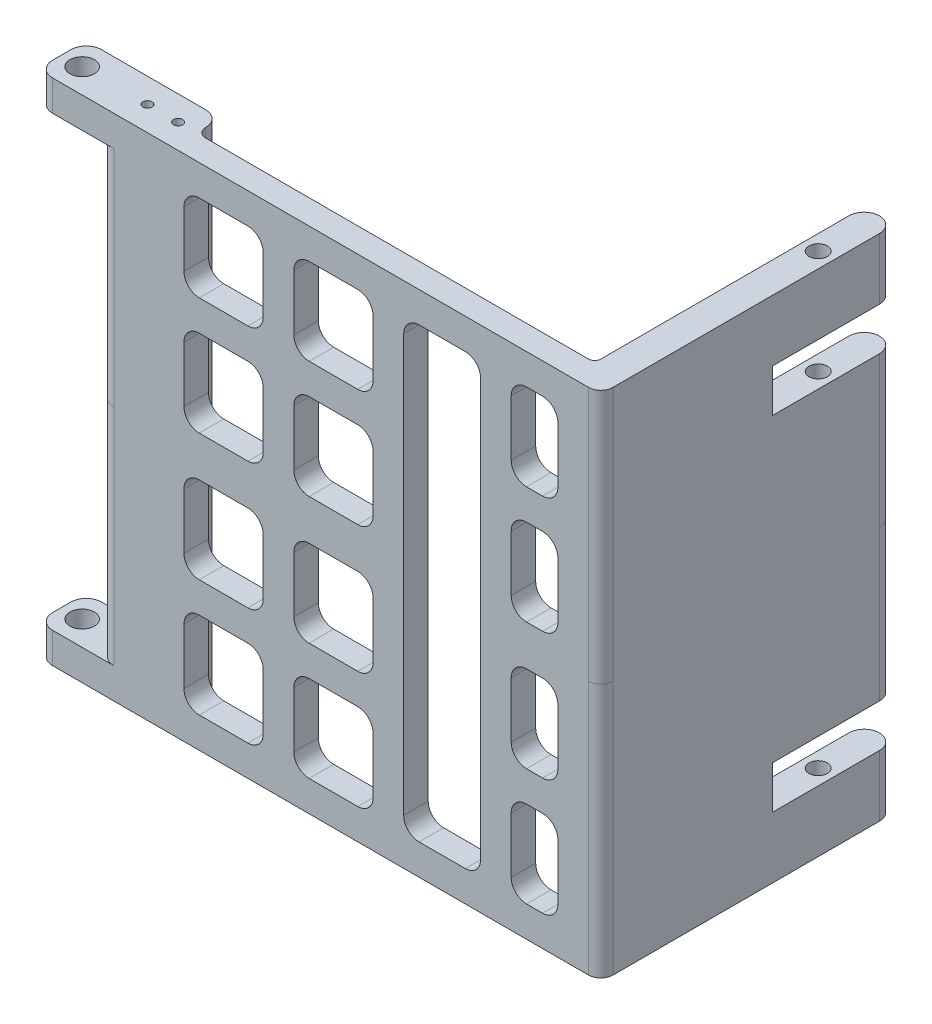
from build123d import *

# Parameters (mm, degrees)
ESBO_O2_W                = 82
ESBO_O2_H                = 41.55
RESSALTO_EXTRUS_O1_DEPTH = 8
ESBO_O3_R                = 0.75
CORTE_EXTRUS_O1_DEPTH    = 80.4806199
ESBO_O7_W                = 40
ESBO_O7_H                = 41.55
RESSALTO_EXTRUS_O2_DEPTH = 5
FILETE1_R                = 2
CORTE_EXTRUS_O3_START    = -8
CORTE_EXTRUS_O3_DEPTH    = 98.795934894
ESBO_O12_W               = 20
ESBO_O12_H               = 7
CORTE_EXTRUS_O4_DEPTH    = 10
ESBO_O19_R               = 1.5
CORTE_EXTRUS_O7_DEPTH    = 89.61810729
ESBO_O17_W               = 10
ESBO_O17_H               = 5
RESSALTO_EXTRUS_O4_DEPTH = 8
ESBO_O20_R               = 2
CORTE_EXTRUS_O9_DEPTH    = 8
FILETE2_R                = 2.5
FILETE3_R                = 2.5
FILETE4_R                = 2.5
FILETE5_R                = 2.5
ESBO_O25_W               = 65
ESBO_O25_H               = 4
CORTE_EXTRUS_O10_DEPTH   = 97.430254151
FILETE8_R                = 1
FILETE9_R                = 2.5
FILETE10_R               = 2.5
FILETE11_R               = 2.5
FILETE12_R               = 1.5
FILETE1_OF_ESPELHAR1_R   = 2
FILETE2_OF_ESPELHAR1_R   = 2.5
FILETE3_OF_ESPELHAR1_R   = 2.5
FILETE4_OF_ESPELHAR1_R   = 2.5
FILETE5_OF_ESPELHAR1_R   = 2.5
FILETE8_OF_ESPELHAR1_R   = 1
FILETE9_OF_ESPELHAR1_R   = 2.5
FILETE10_OF_ESPELHAR1_R  = 2.5
FILETE11_OF_ESPELHAR1_R  = 2.5
FILETE12_OF_ESPELHAR1_R  = 1.5


with BuildPart() as part:
    # Esboço2 → Ressalto-extrusão1 (new body)
    with BuildSketch(Plane.XY):
        with Locations((-26.281248797, -14.332598663)):
            Rectangle(ESBO_O2_W, ESBO_O2_H)
    ressalto_extrus_o1 = extrude(amount=RESSALTO_EXTRUS_O1_DEPTH)

    # Esboço3 → Corte-extrusão1 (cut, through all)
    with BuildSketch(Plane(origin=(0, -35.107598663, 0), x_dir=(-1, 0, 0), z_dir=(0, -1, 0))):
        with Locations(Location((58.281248797, -4, 0), (0, 0, 90))):
            Circle(ESBO_O3_R)
        with Locations(Location((63.281248797, -4, 0), (0, 0, 90))):
            Circle(ESBO_O3_R)
    corte_extrus_o1 = extrude(amount=-CORTE_EXTRUS_O1_DEPTH, mode=Mode.SUBTRACT)

    # Esboço7 → Ressalto-extrusão2 (add)
    with BuildSketch(Plane(origin=(14.718751203, 0, 0), x_dir=(0, 0, -1), z_dir=(1, 0, 0))):
        with Locations((20, -14.332598663)):
            Rectangle(ESBO_O7_W, ESBO_O7_H)
    ressalto_extrus_o2 = extrude(amount=-RESSALTO_EXTRUS_O2_DEPTH)

    # Filete1
    filete1_edges = [part.edges().sort_by_distance(p)[0] for p in [
        (14.718751203, -14.332598663, 8),
    ]]
    fillet(filete1_edges, radius=FILETE1_R)

    # Esboço11 → Corte-extrusão3 (cut)
    with BuildSketch(Plane.XY.offset(8).offset(CORTE_EXTRUS_O3_START)):
        with BuildLine():
            Line((-50.831248797, -30.107598663), (-42.891248797, -30.107598663))
            ThreePointArc((-42.891248797, -30.107598663), (-41.123481844, -29.375365616), (-40.391248797, -27.607598663))
            Line((-40.391248797, -27.607598663), (-40.391248797, -18.487598663))
            ThreePointArc((-40.391248797, -18.487598663), (-41.123481844, -16.71983171), (-42.891248797, -15.987598663))
            Line((-42.891248797, -15.987598663), (-50.831248797, -15.987598663))
            ThreePointArc((-50.831248797, -15.987598663), (-52.59901575, -16.71983171), (-53.331248797, -18.487598663))
            Line((-53.331248797, -18.487598663), (-53.331248797, -27.607598663))
            ThreePointArc((-53.331248797, -27.607598663), (-52.59901575, -29.375365616), (-50.831248797, -30.107598663))
        make_face()
        with BuildLine():
            Line((-50.831248797, 3.132401337), (-42.891248797, 3.132401337))
            ThreePointArc((-42.891248797, 3.132401337), (-41.123481844, 2.40016829), (-40.391248797, 0.632401337))
            Line((-40.391248797, 0.632401337), (-40.391248797, -8.487598663))
            ThreePointArc((-40.391248797, -8.487598663), (-41.123481844, -10.255365616), (-42.891248797, -10.987598663))
            Line((-42.891248797, -10.987598663), (-50.831248797, -10.987598663))
            ThreePointArc((-50.831248797, -10.987598663), (-52.59901575, -10.255365616), (-53.331248797, -8.487598663))
            Line((-53.331248797, -8.487598663), (-53.331248797, 0.632401337))
            ThreePointArc((-53.331248797, 0.632401337), (-52.59901575, 2.40016829), (-50.831248797, 3.132401337))
        make_face()
        with BuildLine():
            Line((5.218751203, 3.132401337), (2.598751203, 3.132401337))
            ThreePointArc((2.598751203, 3.132401337), (0.83098425, 2.40016829), (0.098751203, 0.632401337))
            Line((0.098751203, 0.632401337), (0.098751203, -8.487598663))
            ThreePointArc((0.098751203, -8.487598663), (0.83098425, -10.255365616), (2.598751203, -10.987598663))
            Line((2.598751203, -10.987598663), (5.218751203, -10.987598663))
            ThreePointArc((5.218751203, -10.987598663), (6.986518156, -10.255365616), (7.718751203, -8.487598663))
            Line((7.718751203, -8.487598663), (7.718751203, 0.632401337))
            ThreePointArc((7.718751203, 0.632401337), (6.986518156, 2.40016829), (5.218751203, 3.132401337))
        make_face()
        with BuildLine():
            Line((5.218751203, -30.107598663), (2.598751203, -30.107598663))
            ThreePointArc((2.598751203, -30.107598663), (0.83098425, -29.375365616), (0.098751203, -27.607598663))
            Line((0.098751203, -27.607598663), (0.098751203, -18.487598663))
            ThreePointArc((0.098751203, -18.487598663), (0.83098425, -16.71983171), (2.598751203, -15.987598663))
            Line((2.598751203, -15.987598663), (5.218751203, -15.987598663))
            ThreePointArc((5.218751203, -15.987598663), (6.986518156, -16.71983171), (7.718751203, -18.487598663))
            Line((7.718751203, -18.487598663), (7.718751203, -27.607598663))
            ThreePointArc((7.718751203, -27.607598663), (6.986518156, -29.375365616), (5.218751203, -30.107598663))
        make_face()
        with BuildLine():
            Line((-4.901248797, 6.442401337), (-17.451248797, 6.442401337))
            Line((-17.451248797, 6.442401337), (-17.451248797, -27.607598663))
            ThreePointArc((-17.451248797, -27.607598663), (-16.71901575, -29.375365616), (-14.951248797, -30.107598663))
            Line((-14.951248797, -30.107598663), (-7.401248797, -30.107598663))
            ThreePointArc((-7.401248797, -30.107598663), (-5.633481844, -29.375365616), (-4.901248797, -27.607598663))
            Line((-4.901248797, -27.607598663), (-4.901248797, 6.442401337))
        make_face()
        with BuildLine():
            Line((-32.891248797, -30.107598663), (-24.951248797, -30.107598663))
            ThreePointArc((-24.951248797, -30.107598663), (-23.183481844, -29.375365616), (-22.451248797, -27.607598663))
            Line((-22.451248797, -27.607598663), (-22.451248797, -18.487598663))
            ThreePointArc((-22.451248797, -18.487598663), (-23.183481844, -16.71983171), (-24.951248797, -15.987598663))
            Line((-24.951248797, -15.987598663), (-32.891248797, -15.987598663))
            ThreePointArc((-32.891248797, -15.987598663), (-34.65901575, -16.71983171), (-35.391248797, -18.487598663))
            Line((-35.391248797, -18.487598663), (-35.391248797, -27.607598663))
            ThreePointArc((-35.391248797, -27.607598663), (-34.65901575, -29.375365616), (-32.891248797, -30.107598663))
        make_face()
        with BuildLine():
            Line((-32.891248797, 3.132401337), (-24.951248797, 3.132401337))
            ThreePointArc((-24.951248797, 3.132401337), (-23.183481844, 2.40016829), (-22.451248797, 0.632401337))
            Line((-22.451248797, 0.632401337), (-22.451248797, -8.487598663))
            ThreePointArc((-22.451248797, -8.487598663), (-23.183481844, -10.255365616), (-24.951248797, -10.987598663))
            Line((-24.951248797, -10.987598663), (-32.891248797, -10.987598663))
            ThreePointArc((-32.891248797, -10.987598663), (-34.65901575, -10.255365616), (-35.391248797, -8.487598663))
            Line((-35.391248797, -8.487598663), (-35.391248797, 0.632401337))
            ThreePointArc((-35.391248797, 0.632401337), (-34.65901575, 2.40016829), (-32.891248797, 3.132401337))
        make_face()
    corte_extrus_o3 = extrude(amount=CORTE_EXTRUS_O3_DEPTH, mode=Mode.SUBTRACT)

    # Esboço12 → Corte-extrusão4 (cut)
    with BuildSketch(Plane(origin=(14.718751203, 0, 0), x_dir=(0, 0, -1), z_dir=(1, 0, 0))):
        with Locations((30, -21.607598663)):
            Rectangle(ESBO_O12_W, ESBO_O12_H)
    corte_extrus_o4 = extrude(amount=-CORTE_EXTRUS_O4_DEPTH, mode=Mode.SUBTRACT)

    # Esboço19 → Corte-extrusão7 (cut, through all)
    with BuildSketch(Plane.XZ.offset(35.107598663)):
        with Locations(Location((12.218751203, -30, 0), (0, 0, 270))):
            Circle(ESBO_O19_R)
    corte_extrus_o7 = extrude(amount=-CORTE_EXTRUS_O7_DEPTH, mode=Mode.SUBTRACT)

    # Esboço17 → Ressalto-extrusão4 (add)
    with BuildSketch(Plane(origin=(0, 0, 0), x_dir=(-1, 0, 0), z_dir=(0, 0, -1))):
        with Locations((72.281248797, -32.607598663)):
            Rectangle(ESBO_O17_W, ESBO_O17_H)
    ressalto_extrus_o4 = extrude(amount=-RESSALTO_EXTRUS_O4_DEPTH)

    # Esboço20 → Corte-extrusão9 (cut)
    with BuildSketch(Plane.XZ.offset(35.107598663)):
        with Locations(Location((-73.951248797, 4, 0), (0, 0, 270))):
            Circle(ESBO_O20_R)
    corte_extrus_o9 = extrude(amount=-CORTE_EXTRUS_O9_DEPTH, mode=Mode.SUBTRACT)

    # Filete2
    filete2_edges = [part.edges().sort_by_distance(p)[0] for p in [
        (-67.281248797, -11.832598663, 8),
    ]]
    fillet(filete2_edges, radius=FILETE2_R)

    # Filete3
    filete3_edges = [part.edges().sort_by_distance(p)[0] for p in [
        (-67.281248797, -11.832598663, 0),
    ]]
    fillet(filete3_edges, radius=FILETE3_R)

    # Filete4
    filete4_edges = [part.edges().sort_by_distance(p)[0] for p in [
        (-77.281248797, -32.607598663, 8),
    ]]
    fillet(filete4_edges, radius=FILETE4_R)

    # Filete5
    filete5_edges = [part.edges().sort_by_distance(p)[0] for p in [
        (-77.281248797, -32.607598663, 0),
    ]]
    fillet(filete5_edges, radius=FILETE5_R)

    # Esboço25 → Corte-extrusão10 (cut, through all)
    with BuildSketch(Plane.XZ.offset(35.107598663)):
        with Locations((-22.781248797, 2)):
            Rectangle(ESBO_O25_W, ESBO_O25_H)
    corte_extrus_o10 = extrude(amount=-CORTE_EXTRUS_O10_DEPTH, mode=Mode.SUBTRACT)

    # Filete8
    filete8_edges = [part.edges().sort_by_distance(p)[0] for p in [
        (9.718751203, -14.332598663, 4),
    ]]
    fillet(filete8_edges, radius=FILETE8_R)

    # Filete9
    filete9_edges = [part.edges().sort_by_distance(p)[0] for p in [
        (14.718751203, -30.107598663, -40),
    ]]
    fillet(filete9_edges, radius=FILETE9_R)

    # Filete10
    filete10_edges = [part.edges().sort_by_distance(p)[0] for p in [
        (9.718751203, -30.107598663, -40),
        (9.718751203, -5.832598663, -40),
        (14.718751203, -5.832598663, -40),
    ]]
    fillet(filete10_edges, radius=FILETE10_R - 0.0001)  # a hair under: the kernel refuses the full size

    # Filete11
    filete11_edges = [part.edges().sort_by_distance(p)[0] for p in [
        (-55.281248797, -14.332598663, 0),
    ]]
    fillet(filete11_edges, radius=FILETE11_R)

    # Filete12
    filete12_edges = [part.edges().sort_by_distance(p)[0] for p in [
        (-55.281248797, -14.332598663, 4),
    ]]
    fillet(filete12_edges, radius=FILETE12_R - 0.0001)  # a hair under: the kernel refuses the full size

    # Espelhar1: Ressalto-extrusão1, Corte-extrusão1, Ressalto-extrusão2, Corte-extrusão3, Corte-extrusão4, Corte-extrusão7, Ressalto-extrusão4, Corte-extrusão9, Corte-extrusão10 across plane
    add(ressalto_extrus_o1.mirror(Plane.ZX.offset(6.442401337)))
    add(corte_extrus_o1.mirror(Plane.ZX.offset(6.442401337)), mode=Mode.SUBTRACT)
    add(ressalto_extrus_o2.mirror(Plane.ZX.offset(6.442401337)))
    add(corte_extrus_o3.mirror(Plane.ZX.offset(6.442401337)), mode=Mode.SUBTRACT)
    add(corte_extrus_o4.mirror(Plane.ZX.offset(6.442401337)), mode=Mode.SUBTRACT)
    add(corte_extrus_o7.mirror(Plane.ZX.offset(6.442401337)), mode=Mode.SUBTRACT)
    add(ressalto_extrus_o4.mirror(Plane.ZX.offset(6.442401337)))
    add(corte_extrus_o9.mirror(Plane.ZX.offset(6.442401337)), mode=Mode.SUBTRACT)
    add(corte_extrus_o10.mirror(Plane.ZX.offset(6.442401337)), mode=Mode.SUBTRACT)

    # Filete1 of Espelhar1
    filete1_of_espelhar1_edges = [part.edges().sort_by_distance(p)[0] for p in [
        (14.718751203, 27.217401337, 8),
    ]]
    fillet(filete1_of_espelhar1_edges, radius=FILETE1_OF_ESPELHAR1_R)

    # Filete2 of Espelhar1
    filete2_of_espelhar1_edges = [part.edges().sort_by_distance(p)[0] for p in [
        (-67.281248797, 24.717401337, 8),
    ]]
    fillet(filete2_of_espelhar1_edges, radius=FILETE2_OF_ESPELHAR1_R)

    # Filete3 of Espelhar1
    filete3_of_espelhar1_edges = [part.edges().sort_by_distance(p)[0] for p in [
        (-67.281248797, 24.717401337, 0),
    ]]
    fillet(filete3_of_espelhar1_edges, radius=FILETE3_OF_ESPELHAR1_R)

    # Filete4 of Espelhar1
    filete4_of_espelhar1_edges = [part.edges().sort_by_distance(p)[0] for p in [
        (-77.281248797, 45.492401337, 8),
    ]]
    fillet(filete4_of_espelhar1_edges, radius=FILETE4_OF_ESPELHAR1_R)

    # Filete5 of Espelhar1
    filete5_of_espelhar1_edges = [part.edges().sort_by_distance(p)[0] for p in [
        (-77.281248797, 45.492401337, 0),
    ]]
    fillet(filete5_of_espelhar1_edges, radius=FILETE5_OF_ESPELHAR1_R)

    # Filete8 of Espelhar1
    filete8_of_espelhar1_edges = [part.edges().sort_by_distance(p)[0] for p in [
        (9.718751203, 27.217401337, 4),
    ]]
    fillet(filete8_of_espelhar1_edges, radius=FILETE8_OF_ESPELHAR1_R)

    # Filete9 of Espelhar1
    filete9_of_espelhar1_edges = [part.edges().sort_by_distance(p)[0] for p in [
        (14.718751203, 42.992401337, -40),
    ]]
    fillet(filete9_of_espelhar1_edges, radius=FILETE9_OF_ESPELHAR1_R)

    # Filete10 of Espelhar1
    filete10_of_espelhar1_edges = [part.edges().sort_by_distance(p)[0] for p in [
        (9.718751203, 42.992401337, -40),
        (9.718751203, 18.717401337, -40),
        (14.718751203, 18.717401337, -40),
    ]]
    fillet(filete10_of_espelhar1_edges, radius=FILETE10_OF_ESPELHAR1_R - 0.0001)  # a hair under: the kernel refuses the full size

    # Filete11 of Espelhar1
    filete11_of_espelhar1_edges = [part.edges().sort_by_distance(p)[0] for p in [
        (-55.281248797, 27.217401337, 0),
    ]]
    fillet(filete11_of_espelhar1_edges, radius=FILETE11_OF_ESPELHAR1_R)

    # Filete12 of Espelhar1
    filete12_of_espelhar1_edges = [part.edges().sort_by_distance(p)[0] for p in [
        (-55.281248797, 6.442401337, 4),
    ]]
    fillet(filete12_of_espelhar1_edges, radius=FILETE12_OF_ESPELHAR1_R - 0.0001)  # a hair under: the kernel refuses the full size


solid = part.part
